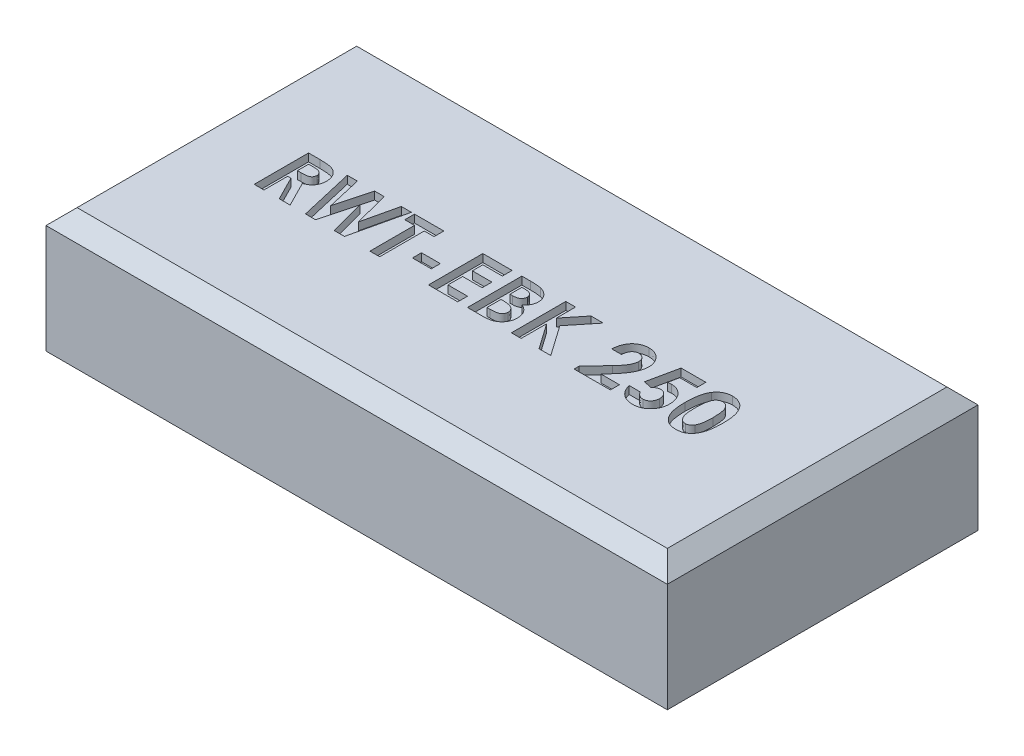
from build123d import *

# Parameters (mm, degrees)
SKETCH1_W           = 40
SKETCH1_H           = 20
BOSS_EXTRUDE1_DEPTH = 8
CHAMFER1_SIZE       = 1
SKETCH4_W           = 1.211538461
SKETCH4_H           = 0.583333333
CUT_EXTRUDE3_DEPTH  = 0.5


with BuildPart() as part:
    # Sketch1 → Boss-Extrude1 (new body)
    with BuildSketch(Plane(origin=(0, 0, 0), x_dir=(1, 0, 0), z_dir=(0, 1, 0))):
        with Locations((0, 2.318501171)):
            Rectangle(SKETCH1_W, SKETCH1_H)
    extrude(amount=BOSS_EXTRUDE1_DEPTH)

    # Chamfer1
    chamfer1_edges = [part.edges().sort_by_distance(p)[0] for p in [
        (0, 8, 7.681498829),
        (-20, 8, -2.318501171),
        (0, 8, -12.318501171),
        (20, 8, -2.318501171),
    ]]
    chamfer(chamfer1_edges, length=CHAMFER1_SIZE)

    # Sketch4 → Cut-Extrude3 (cut)
    # profile 1 of 10: a face of its own
    with BuildSketch(Plane(origin=(0, 8, 0), x_dir=(1, 0, 0), z_dir=(0, 1, 0))):
        with BuildLine():
            Line((-14.596153846, 3.818501171), (-13.864182692, 3.818501171))
            add(Edge.make_bspline(
                [(-13.864182692, 3.818501171), (-13.815799622, 3.818329439), (-13.722745349, 3.81799915), (-13.588566169, 3.81278806), (-13.46530414, 3.805536401), (-13.352776761, 3.794470177), (-13.251032173, 3.779797701), (-13.159968404, 3.76250128), (-13.079588115, 3.742788301), (-13.009213411, 3.718224373), (-12.945703721, 3.690516634), (-12.886503859, 3.658679935), (-12.830307791, 3.623068786), (-12.777491125, 3.582746162), (-12.727594872, 3.538437457), (-12.6805249, 3.49009807), (-12.636946351, 3.437318103), (-12.597129066, 3.380431058), (-12.560838815, 3.320587191), (-12.528765845, 3.257704336), (-12.502684052, 3.191738763), (-12.479637993, 3.123643816), (-12.463038663, 3.052446065), (-12.451494071, 2.978838632), (-12.443041573, 2.902562411), (-12.442555595, 2.850743733), (-12.442307692, 2.824310466)],
                knots=[0, 0, 0, 0, 1.749336639, 3.364467119, 4.854658419, 6.213483162, 7.451590619, 8.570285859, 9.5643256, 10.440900261, 11.26203566, 12.067320669, 12.869050712, 13.665104639, 14.467235401, 15.27997916, 16.102287765, 16.939272006, 17.78853747, 18.631303466, 19.488103222, 20.351255419, 21.228522269, 22.127379805, 23.044756219, 24, 24, 24, 24], degree=3))
            add(Edge.make_bspline(
                [(-12.442307692, 2.824310466), (-12.442951654, 2.796720207), (-12.444214347, 2.742620739), (-12.451015895, 2.663153032), (-12.46344699, 2.587123888), (-12.48227569, 2.514755912), (-12.503916836, 2.4451484), (-12.532694008, 2.379585653), (-12.565171892, 2.317114157), (-12.603744925, 2.258617595), (-12.646076944, 2.20279664), (-12.695308193, 2.151790002), (-12.748249241, 2.102856265), (-12.807876098, 2.059060474), (-12.871560358, 2.017441316), (-12.940567358, 1.979723274), (-13.014446736, 1.944958206), (-13.066387598, 1.925570802), (-13.092948718, 1.91565662)],
                knots=[0, 0, 0, 0, 1.099860209, 2.156625411, 3.176576793, 4.16617041, 5.135385252, 6.078461593, 7.016046972, 7.938469504, 8.868247731, 9.803980173, 10.76021508, 11.73834243, 12.748633912, 13.790971185, 14.870363756, 16, 16, 16, 16], degree=3))
            Line((-13.092948718, 1.91565662), (-12.28525641, 0.318501171))
            Line((-12.28525641, 0.318501171), (-12.983573718, 0.318501171))
            Line((-12.983573718, 0.318501171), (-13.754807692, 1.844142197))
            Line((-13.754807692, 1.844142197), (-13.967948718, 1.844142197))
            Line((-13.967948718, 1.844142197), (-13.967948718, 0.318501171))
            Line((-13.967948718, 0.318501171), (-14.596153846, 0.318501171))
            Line((-14.596153846, 0.318501171), (-14.596153846, 3.818501171))
        make_face()
        with BuildLine():
            Line((-13.967948718, 2.472347325), (-13.723257212, 2.472347325))
            add(Edge.make_bspline(
                [(-13.723257212, 2.472347325), (-13.693341641, 2.472684254), (-13.636059751, 2.473329401), (-13.55368087, 2.476321861), (-13.4788612, 2.483532211), (-13.41127944, 2.492642218), (-13.350595524, 2.503161037), (-13.297350732, 2.518235143), (-13.250724642, 2.534387429), (-13.211269776, 2.554460531), (-13.177560445, 2.577288002), (-13.148454596, 2.603220576), (-13.124379885, 2.633234229), (-13.104565169, 2.666513318), (-13.089151475, 2.70335219), (-13.07790066, 2.743346436), (-13.071613117, 2.786951643), (-13.070889714, 2.817045173), (-13.070512821, 2.832723927)],
                knots=[0, 0, 0, 0, 1.688639943, 3.233382647, 4.650958383, 5.928841754, 7.082724185, 8.122798841, 9.049171256, 9.863274652, 10.613301712, 11.341792392, 12.054588806, 12.776240173, 13.521029143, 14.301969904, 15.115324896, 16, 16, 16, 16], degree=3))
            add(Edge.make_bspline(
                [(-13.070512821, 2.832723927), (-13.071225372, 2.851273039), (-13.072625049, 2.88770933), (-13.086514186, 2.940164814), (-13.108622693, 2.988715953), (-13.1389274, 3.033143381), (-13.177092239, 3.072091531), (-13.220889403, 3.106424636), (-13.27126414, 3.133572687), (-13.317907356, 3.151479252), (-13.36034178, 3.162192934), (-13.398637509, 3.170176676), (-13.442984193, 3.175834983), (-13.493415313, 3.181836624), (-13.549802317, 3.185728385), (-13.612452548, 3.188568594), (-13.681186076, 3.189730664), (-13.729099873, 3.190102157), (-13.754106571, 3.190296043)],
                knots=[0, 0, 0, 0, 1.020303359, 2.004196876, 2.966617323, 3.9489082, 4.950758222, 5.960522915, 7.003732012, 8.091992268, 8.70421221, 9.413913587, 10.24622431, 11.166358409, 12.212345909, 13.359657661, 14.621978493, 16, 16, 16, 16], degree=3))
            Line((-13.754106571, 3.190296043), (-13.967948718, 3.190296043))
            Line((-13.967948718, 3.190296043), (-13.967948718, 2.472347325))
        make_face(mode=Mode.SUBTRACT)
    # profile 2 of 10: a face of its own
    with BuildSketch(Plane(origin=(0, 8, 0), x_dir=(1, 0, 0), z_dir=(0, 1, 0))):
        Polygon((-12.105769231, 3.818501171), (-11.457231571, 3.818501171), (-10.939102564, 1.584026011), (-10.345252404, 3.818501171), (-9.734575321, 3.818501171), (-9.144230769, 1.584026011), (-8.627504006, 3.818501171), (-7.977564103, 3.818501171), (-8.787359776, 0.318501171), (-9.443609776, 0.318501171), (-10.041666667, 2.581021203), (-10.643229167, 0.318501171), (-11.294571314, 0.318501171), align=None)
    # profile 3 of 10: a face of its own
    with BuildSketch(Plane(origin=(0, 8, 0), x_dir=(1, 0, 0), z_dir=(0, 1, 0))):
        Polygon((-7.775641026, 3.818501171), (-5.891025641, 3.818501171), (-5.891025641, 3.190296043), (-6.519230769, 3.190296043), (-6.519230769, 0.318501171), (-7.147435897, 0.318501171), (-7.147435897, 3.190296043), (-7.775641026, 3.190296043), align=None)
    # profile 4 of 10: a face of its own
    with BuildSketch(Plane(origin=(0, 8, 0), x_dir=(1, 0, 0), z_dir=(0, 1, 0))):
        with Locations((-4.791666667, 1.597347325)):
            Rectangle(SKETCH4_W, SKETCH4_H)
    # profile 5 of 10: a face of its own
    with BuildSketch(Plane(origin=(0, 8, 0), x_dir=(1, 0, 0), z_dir=(0, 1, 0))):
        Polygon((-3.378205128, 3.818501171), (-1.493589744, 3.818501171), (-1.493589744, 3.190296043), (-2.75, 3.190296043), (-2.75, 2.51721912), (-1.493589744, 2.51721912), (-1.493589744, 1.889013991), (-2.75, 1.889013991), (-2.75, 0.946706299), (-1.493589744, 0.946706299), (-1.493589744, 0.318501171), (-3.378205128, 0.318501171), align=None)
    # profile 6 of 10: a face of its own
    with BuildSketch(Plane(origin=(0, 8, 0), x_dir=(1, 0, 0), z_dir=(0, 1, 0))):
        with BuildLine():
            Line((-0.865384615, 0.318501171), (-0.865384615, 3.818501171))
            Line((-0.865384615, 3.818501171), (-0.304487179, 3.818501171))
            add(Edge.make_bspline(
                [(-0.304487179, 3.818501171), (-0.265220852, 3.818505652), (-0.189241252, 3.818514323), (-0.079622519, 3.814664873), (0.022039599, 3.809685178), (0.115421572, 3.804114058), (0.200682344, 3.794513904), (0.277692262, 3.784396391), (0.346605192, 3.772195293), (0.389210312, 3.76125053), (0.409254808, 3.756101331)],
                knots=[0, 0, 0, 0, 1.311965854, 2.538629056, 3.664479157, 4.713267157, 5.663616078, 6.530575999, 7.308677837, 8, 8, 8, 8], degree=3))
            add(Edge.make_bspline(
                [(0.409254808, 3.756101331), (0.435575266, 3.748838294), (0.487224455, 3.734585883), (0.561202576, 3.705802524), (0.631381143, 3.673807779), (0.697674471, 3.637307759), (0.759675491, 3.595861807), (0.817148578, 3.549140995), (0.871333285, 3.499020694), (0.920305637, 3.444104065), (0.964568575, 3.386074475), (1.003025131, 3.324947127), (1.03643895, 3.2616567), (1.063178757, 3.195406725), (1.083326699, 3.126502301), (1.09806282, 3.055237661), (1.107613822, 2.981387306), (1.108516267, 2.931144495), (1.108974359, 2.905640594)],
                knots=[0, 0, 0, 0, 1.099996261, 2.158545794, 3.195537121, 4.207578794, 5.205712374, 6.197378256, 7.190519799, 8.17788031, 9.159561366, 10.129234751, 11.085776129, 12.040971148, 13.00380137, 13.975669004, 14.972423361, 16, 16, 16, 16], degree=3))
            add(Edge.make_bspline(
                [(1.108974359, 2.905640594), (1.107776583, 2.872874775), (1.105418909, 2.808379286), (1.090357925, 2.713647082), (1.062116233, 2.624111532), (1.025162666, 2.538122532), (0.974917368, 2.456000819), (0.911115557, 2.377785442), (0.834790614, 2.30106803), (0.776245169, 2.255081117), (0.745793269, 2.231161427)],
                knots=[0, 0, 0, 0, 0.986156485, 1.941127874, 2.875419072, 3.804401753, 4.751181392, 5.761612777, 6.835722519, 8, 8, 8, 8], degree=3))
            add(Edge.make_bspline(
                [(0.745793269, 2.231161427), (0.770470028, 2.218564156), (0.818854324, 2.193864392), (0.887545811, 2.153265354), (0.951146629, 2.110083128), (1.009941945, 2.065186558), (1.062698461, 2.016672412), (1.111594582, 1.967336144), (1.154218027, 1.914350989), (1.192333195, 1.85960544), (1.225462281, 1.802306775), (1.254314061, 1.742551757), (1.278684124, 1.680136252), (1.299321324, 1.615377904), (1.314712554, 1.548053973), (1.324747963, 1.478140383), (1.332431699, 1.405875574), (1.333029422, 1.35665059), (1.333333333, 1.331622165)],
                knots=[0, 0, 0, 0, 1.164658916, 2.283573913, 3.35186032, 4.395461096, 5.390182219, 6.362969632, 7.312859996, 8.245001507, 9.165155236, 10.092416118, 11.032087915, 11.979892451, 12.947605196, 13.931445124, 14.948243989, 16, 16, 16, 16], degree=3))
            add(Edge.make_bspline(
                [(1.333333333, 1.331622165), (1.331361149, 1.283819302), (1.327469051, 1.189480545), (1.29901193, 1.050969584), (1.249676325, 0.91964863), (1.18342878, 0.796039608), (1.101799059, 0.683720797), (1.007948289, 0.585330494), (0.902821331, 0.502045287), (0.805829006, 0.445834233), (0.721938284, 0.40811136), (0.652453165, 0.384788701), (0.577827621, 0.363182624), (0.49669469, 0.348010391), (0.410525202, 0.334123096), (0.318478999, 0.325548791), (0.220728113, 0.319738197), (0.153588579, 0.318921849), (0.118990385, 0.318501171)],
                knots=[0, 0, 0, 0, 1.284142165, 2.534249414, 3.780121997, 5.041676246, 6.291546858, 7.49970053, 8.684500223, 9.883330709, 10.50184324, 11.153274765, 11.851151195, 12.587658647, 13.369265475, 14.195992086, 15.070362669, 16, 16, 16, 16], degree=3))
            Line((0.118990385, 0.318501171), (-0.865384615, 0.318501171))
        make_face()
        with BuildLine():
            Line((-0.237179487, 3.190296043), (-0.237179487, 2.42747553))
            Line((-0.237179487, 2.42747553), (-0.0703125, 2.42747553))
            add(Edge.make_bspline(
                [(-0.0703125, 2.42747553), (-0.047633777, 2.427673297), (-0.003853875, 2.428055074), (0.059381549, 2.432972233), (0.118180282, 2.441361212), (0.172319311, 2.453065948), (0.222302963, 2.467929257), (0.267811927, 2.485813017), (0.308646108, 2.507633149), (0.356085982, 2.540135198), (0.406233349, 2.587963419), (0.450377513, 2.657061193), (0.476378131, 2.736523371), (0.479273899, 2.792566252), (0.480769231, 2.821505979)],
                knots=[0, 0, 0, 0, 1.065314748, 2.056525647, 2.977365736, 3.853934255, 4.656397591, 5.425096493, 6.14721249, 6.826394842, 8.123232004, 9.372140726, 10.643011755, 12, 12, 12, 12], degree=3))
            add(Edge.make_bspline(
                [(0.480769231, 2.821505979), (0.479572691, 2.848612841), (0.47725923, 2.901022871), (0.451079951, 2.97461122), (0.410418355, 3.039825558), (0.362411626, 3.084459439), (0.317203962, 3.114943064), (0.278494386, 3.135015233), (0.236007719, 3.152983634), (0.188921466, 3.166722711), (0.137504514, 3.17703203), (0.082006625, 3.184602991), (0.022332045, 3.189756109), (-0.018885315, 3.190112204), (-0.040164263, 3.190296043)],
                knots=[0, 0, 0, 0, 1.347982417, 2.606269829, 3.849316587, 5.153353503, 5.842674298, 6.568177932, 7.326619318, 8.142485038, 9.012069166, 9.942760135, 10.937925643, 12, 12, 12, 12], degree=3))
            Line((-0.040164263, 3.190296043), (-0.237179487, 3.190296043))
        make_face(mode=Mode.SUBTRACT)
        with BuildLine():
            Line((-0.237179487, 1.844142197), (-0.237179487, 0.946706299))
            Line((-0.237179487, 0.946706299), (-0.056290064, 0.946706299))
            add(Edge.make_bspline(
                [(-0.056290064, 0.946706299), (-0.020527995, 0.946910607), (0.048229046, 0.947303413), (0.146723385, 0.952049449), (0.236279363, 0.960603342), (0.316659689, 0.971282188), (0.387987483, 0.985750355), (0.450021639, 1.004144774), (0.503612874, 1.02438184), (0.548439854, 1.049377018), (0.585060929, 1.078465208), (0.618107609, 1.108194036), (0.645051813, 1.142489048), (0.666370569, 1.179878054), (0.684821916, 1.219432285), (0.695950465, 1.262696318), (0.704423352, 1.308387911), (0.704889637, 1.339991798), (0.705128205, 1.356161427)],
                knots=[0, 0, 0, 0, 1.753078804, 3.370512758, 4.83203934, 6.162291463, 7.344201807, 8.395507345, 9.331626367, 10.147333109, 10.898971645, 11.62040215, 12.321813352, 13.025280112, 13.727906689, 14.453419512, 15.208716525, 16, 16, 16, 16], degree=3))
            add(Edge.make_bspline(
                [(0.705128205, 1.356161427), (0.704602095, 1.374651653), (0.703577374, 1.410665639), (0.695208464, 1.463303922), (0.67999942, 1.512445252), (0.660842888, 1.559346239), (0.634185556, 1.602327663), (0.602504228, 1.642876951), (0.564225095, 1.679620976), (0.521177978, 1.714782156), (0.470967777, 1.745567673), (0.413570936, 1.772279563), (0.348675643, 1.79458835), (0.27608088, 1.81235062), (0.196104895, 1.827425213), (0.108163951, 1.83642641), (0.012990452, 1.843120995), (-0.053004401, 1.843794061), (-0.087139423, 1.844142197)],
                knots=[0, 0, 0, 0, 0.845221588, 1.646264278, 2.427170338, 3.19324141, 3.95557735, 4.731569926, 5.540061037, 6.376114724, 7.268642756, 8.224665384, 9.265483498, 10.400594375, 11.639216012, 12.983232105, 14.439614077, 16, 16, 16, 16], degree=3))
            Line((-0.087139423, 1.844142197), (-0.237179487, 1.844142197))
        make_face(mode=Mode.SUBTRACT)
    # profile 7 of 10: a face of its own
    with BuildSketch(Plane(origin=(0, 8, 0), x_dir=(1, 0, 0), z_dir=(0, 1, 0))):
        Polygon((1.961538462, 3.818501171), (2.58974359, 3.818501171), (2.58974359, 2.586630177), (3.582532051, 3.818501171), (4.375500801, 3.818501171), (3.128205128, 2.270424248), (4.496794872, 0.318501171), (3.740284455, 0.318501171), (2.58974359, 1.959827293), (2.58974359, 0.318501171), (1.961538462, 0.318501171), align=None)
    # profile 8 of 10: a face of its own
    with BuildSketch(Plane(origin=(0, 8, 0), x_dir=(1, 0, 0), z_dir=(0, 1, 0))):
        with BuildLine():
            Line((6.717948718, 2.651834504), (6.08974359, 2.651834504))
            add(Edge.make_bspline(
                [(6.08974359, 2.651834504), (6.092456711, 2.699354899), (6.097757988, 2.792206896), (6.118845127, 2.927077396), (6.147101169, 3.054515188), (6.184812609, 3.174074479), (6.232199501, 3.285711827), (6.288042457, 3.389807809), (6.353768139, 3.485814357), (6.427977688, 3.573268474), (6.50941123, 3.65172437), (6.596378125, 3.721288296), (6.690208648, 3.778690696), (6.789188439, 3.825927558), (6.893300645, 3.863667615), (7.003530329, 3.888899897), (7.118923064, 3.905987446), (7.197918735, 3.907482675), (7.23818109, 3.908244761)],
                knots=[0, 0, 0, 0, 1.199038563, 2.342849363, 3.436047546, 4.486744587, 5.497670872, 6.488682221, 7.459191391, 8.424610317, 9.374430501, 10.305433194, 11.225809216, 12.140057399, 13.06607119, 14.010487599, 14.985989317, 16, 16, 16, 16], degree=3))
            add(Edge.make_bspline(
                [(7.23818109, 3.908244761), (7.287602559, 3.906702681), (7.38408485, 3.903692179), (7.52428127, 3.878011599), (7.655209399, 3.835056862), (7.776774062, 3.775037765), (7.88794036, 3.698789794), (7.988689856, 3.607876567), (8.075975727, 3.500390678), (8.15035139, 3.380804438), (8.212148677, 3.254179441), (8.255453641, 3.123243943), (8.283917528, 2.991472441), (8.286953378, 2.902744181), (8.288461538, 2.858665434)],
                knots=[0, 0, 0, 0, 1.075374347, 2.099382735, 3.09057751, 4.06680945, 5.040638231, 6.016817125, 7.011024321, 8.044445721, 9.0776792, 10.070479129, 11.0414456, 12, 12, 12, 12], degree=3))
            add(Edge.make_bspline(
                [(8.288461538, 2.858665434), (8.28787434, 2.832003492), (8.286692456, 2.778339588), (8.278474655, 2.697132932), (8.26614633, 2.614414458), (8.24755822, 2.53025509), (8.224377324, 2.444631236), (8.196255546, 2.357286655), (8.162540574, 2.268716557), (8.123795042, 2.177924102), (8.077571525, 2.084614522), (8.023750665, 1.98738907), (7.960903933, 1.886333992), (7.889790439, 1.7808787), (7.810064803, 1.671189511), (7.721337829, 1.557596844), (7.624631444, 1.439700436), (7.555996202, 1.360893303), (7.520733173, 1.320404216)],
                knots=[0, 0, 0, 0, 0.728284026, 1.46585585, 2.227944881, 3.01186502, 3.81876927, 4.650621989, 5.517437689, 6.406905708, 7.346299482, 8.360816762, 9.441613733, 10.596154504, 11.834900912, 13.145207542, 14.533280747, 16, 16, 16, 16], degree=3))
            Line((7.520733173, 1.320404216), (7.155448718, 0.901834504))
            Line((7.155448718, 0.901834504), (8.333333333, 0.901834504))
            Line((8.333333333, 0.901834504), (8.333333333, 0.318501171))
            Line((8.333333333, 0.318501171), (6, 0.318501171))
            Line((6, 0.318501171), (6, 0.636810466))
            Line((6, 0.636810466), (7.036258013, 1.739675049))
            add(Edge.make_bspline(
                [(7.036258013, 1.739675049), (7.066260345, 1.771845952), (7.124365966, 1.834151449), (7.207044276, 1.9256537), (7.281860843, 2.012487153), (7.347264285, 2.095576408), (7.40668689, 2.172226387), (7.457479009, 2.244747418), (7.50010535, 2.312483883), (7.546382289, 2.39416223), (7.590330169, 2.491578193), (7.630655009, 2.603805377), (7.655235789, 2.711068718), (7.658628714, 2.780963817), (7.66025641, 2.814494761)],
                knots=[0, 0, 0, 0, 1.246127091, 2.413378631, 3.493388633, 4.492180848, 5.408488754, 6.240484944, 6.999099869, 7.674939598, 8.898438119, 10.020720584, 11.050475521, 12, 12, 12, 12], degree=3))
            add(Edge.make_bspline(
                [(7.66025641, 2.814494761), (7.659039421, 2.846933362), (7.65668131, 2.909788353), (7.630767577, 2.999199244), (7.590621122, 3.080151677), (7.534049098, 3.150226705), (7.465522659, 3.207812002), (7.386333921, 3.250642327), (7.297128506, 3.275355229), (7.234593811, 3.278448401), (7.202423878, 3.280039632)],
                knots=[0, 0, 0, 0, 1.062038974, 2.057870785, 3.028805853, 4.01125022, 4.991535629, 5.949134679, 6.94496649, 8, 8, 8, 8], degree=3))
            add(Edge.make_bspline(
                [(7.202423878, 3.280039632), (7.185804481, 3.279451813), (7.153086529, 3.278294595), (7.104993697, 3.27059131), (7.059229913, 3.257015074), (7.015285799, 3.238824829), (6.973630338, 3.214713529), (6.9343686, 3.184992509), (6.897086913, 3.15041705), (6.861956264, 3.111095263), (6.829982787, 3.067212138), (6.801584062, 3.019168456), (6.778103044, 2.966994041), (6.757429502, 2.911377673), (6.741485078, 2.851721988), (6.729875559, 2.788384019), (6.721049617, 2.721466807), (6.719001154, 2.675467517), (6.717948718, 2.651834504)],
                knots=[0, 0, 0, 0, 0.903469896, 1.778625579, 2.63899355, 3.493148037, 4.358286772, 5.247621495, 6.164656832, 7.118446693, 8.109501108, 9.111810964, 10.146451449, 11.215617525, 12.33435995, 13.498009769, 14.714554818, 16, 16, 16, 16], degree=3))
        make_face()
    # profile 9 of 10: a face of its own
    with BuildSketch(Plane(origin=(0, 8, 0), x_dir=(1, 0, 0), z_dir=(0, 1, 0))):
        with BuildLine():
            Line((9.387119391, 3.818501171), (10.980769231, 3.818501171))
            Line((10.980769231, 3.818501171), (10.980769231, 3.235167838))
            Line((10.980769231, 3.235167838), (9.884915865, 3.235167838))
            Line((9.884915865, 3.235167838), (9.748197115, 2.573308863))
            add(Edge.make_bspline(
                [(9.748197115, 2.573308863), (9.766827002, 2.578497522), (9.803568967, 2.588730623), (9.858920782, 2.598993128), (9.912564404, 2.605644958), (9.947765022, 2.606532224), (9.96484375, 2.606962709)],
                knots=[0, 0, 0, 0, 1.05461699, 2.079921384, 3.068411212, 4, 4, 4, 4], degree=3))
            add(Edge.make_bspline(
                [(9.96484375, 2.606962709), (10.002060088, 2.606109919), (10.075421688, 2.60442888), (10.1827404, 2.588470341), (10.285504407, 2.563336125), (10.383399238, 2.527489548), (10.476329265, 2.480834303), (10.564407137, 2.424394534), (10.647740954, 2.358071113), (10.724850358, 2.281822516), (10.795701698, 2.19809983), (10.857302898, 2.107544887), (10.909914167, 2.011448911), (10.951759351, 1.909214572), (10.984787138, 1.801483971), (11.008653754, 1.688188071), (11.022767277, 1.569192598), (11.024670399, 1.488010495), (11.025641026, 1.446606139)],
                knots=[0, 0, 0, 0, 1.01440847, 1.999622559, 2.951875003, 3.895578053, 4.836219714, 5.782137149, 6.743708247, 7.735272588, 8.734977101, 9.730283169, 10.717124674, 11.717316708, 12.737475749, 13.78628267, 14.87096371, 16, 16, 16, 16], degree=3))
            add(Edge.make_bspline(
                [(11.025641026, 1.446606139), (11.024454904, 1.404731748), (11.022114339, 1.322101333), (11.006844297, 1.200605395), (10.979892399, 1.084239715), (10.94287127, 0.972692784), (10.894098303, 0.866784445), (10.835442135, 0.765417568), (10.765911048, 0.669344566), (10.68618738, 0.579550304), (10.599517296, 0.497476624), (10.507234115, 0.425276252), (10.409986156, 0.364520223), (10.30777107, 0.31541908), (10.2011753, 0.276571129), (10.090166491, 0.248291676), (9.974205155, 0.232074981), (9.895482475, 0.229875532), (9.85546875, 0.228757581)],
                knots=[0, 0, 0, 0, 1.06808661, 2.107647099, 3.116961351, 4.110378221, 5.100014249, 6.085620622, 7.093190682, 8.119403071, 9.144090782, 10.133780668, 11.103064255, 12.062861538, 13.020824475, 13.992378307, 14.979551724, 16, 16, 16, 16], degree=3))
            add(Edge.make_bspline(
                [(9.85546875, 0.228757581), (9.819685666, 0.229672135), (9.749113937, 0.231475826), (9.645164879, 0.242562264), (9.544946443, 0.262163189), (9.44899068, 0.290530803), (9.356287975, 0.32544486), (9.267909998, 0.369111487), (9.183371097, 0.420699211), (9.102911331, 0.479266557), (9.027838055, 0.545240399), (8.959319124, 0.617460138), (8.896939715, 0.695015476), (8.84203465, 0.778863212), (8.79477604, 0.868879466), (8.75286614, 0.964003375), (8.718562467, 1.065228337), (8.701154341, 1.135403104), (8.692307692, 1.171065274)],
                knots=[0, 0, 0, 0, 1.054957082, 2.080596141, 3.077793124, 4.061112343, 5.027190972, 5.994718051, 6.962465889, 7.943658696, 8.924948258, 9.904494768, 10.875059, 11.855380583, 12.854004648, 13.869083016, 14.917087635, 16, 16, 16, 16], degree=3))
            Line((8.692307692, 1.171065274), (9.41025641, 1.171065274))
            add(Edge.make_bspline(
                [(9.41025641, 1.171065274), (9.42338053, 1.146352842), (9.448885759, 1.098327052), (9.497402344, 1.034565599), (9.551713581, 0.980192572), (9.611329552, 0.934676733), (9.676636533, 0.900577041), (9.744973386, 0.874717413), (9.8171986, 0.859774091), (9.86638716, 0.857906028), (9.891225962, 0.856962709)],
                knots=[0, 0, 0, 0, 1.104910296, 2.147267069, 3.153527244, 4.136738762, 5.099945312, 6.05603338, 7.018353, 8, 8, 8, 8], degree=3))
            add(Edge.make_bspline(
                [(9.891225962, 0.856962709), (9.908538273, 0.857614079), (9.942600538, 0.858895659), (9.9927859, 0.86567554), (10.040690032, 0.87851648), (10.086669091, 0.896298197), (10.130846587, 0.918474006), (10.172589223, 0.946469521), (10.212623243, 0.978693396), (10.250339168, 1.015670402), (10.284498925, 1.056891163), (10.314453296, 1.10118568), (10.341236634, 1.14756972), (10.361075462, 1.197880672), (10.377321784, 1.250616232), (10.389286233, 1.306174201), (10.396436341, 1.364619465), (10.397098249, 1.404518409), (10.397435897, 1.424871363)],
                knots=[0, 0, 0, 0, 0.978869489, 1.925942215, 2.855067702, 3.774946051, 4.70828698, 5.642468714, 6.60995405, 7.609372294, 8.622401667, 9.629904756, 10.629323, 11.642352373, 12.678539694, 13.745912462, 14.850161547, 16, 16, 16, 16], degree=3))
            add(Edge.make_bspline(
                [(10.397435897, 1.424871363), (10.397044018, 1.444751879), (10.396281215, 1.483449786), (10.389971156, 1.540272174), (10.378682582, 1.594186337), (10.363301804, 1.645605217), (10.343612571, 1.694216573), (10.319551013, 1.740309765), (10.291014335, 1.783651807), (10.257849331, 1.823360298), (10.222482512, 1.859782055), (10.184487184, 1.891636234), (10.144205664, 1.918072991), (10.102889652, 1.941153049), (10.05888996, 1.957950212), (10.013195966, 1.969517798), (9.965855722, 1.978005628), (9.933565969, 1.978504319), (9.917167468, 1.978757581)],
                knots=[0, 0, 0, 0, 1.166249705, 2.270133367, 3.348514167, 4.393962215, 5.415026464, 6.420877785, 7.440098956, 8.453121383, 9.451844239, 10.415694839, 11.355045125, 12.27538808, 13.187007209, 14.108269027, 15.039275622, 16, 16, 16, 16], degree=3))
            add(Edge.make_bspline(
                [(9.917167468, 1.978757581), (9.899354884, 1.978081693), (9.863654645, 1.976727067), (9.810613025, 1.965704839), (9.75821094, 1.94786674), (9.706156979, 1.923256255), (9.654967869, 1.891048895), (9.603292704, 1.853273355), (9.552861163, 1.807184883), (9.520795387, 1.772858084), (9.504206731, 1.755099729)],
                knots=[0, 0, 0, 0, 0.88288272, 1.769486374, 2.674910571, 3.623812639, 4.617874466, 5.670434592, 6.794841017, 8, 8, 8, 8], degree=3))
            Line((9.504206731, 1.755099729), (8.975560897, 1.876393799))
            Line((8.975560897, 1.876393799), (9.387119391, 3.818501171))
        make_face()
    # profile 10 of 10: a face of its own
    with BuildSketch(Plane(origin=(0, 8, 0), x_dir=(1, 0, 0), z_dir=(0, 1, 0))):
        with BuildLine():
            add(Edge.make_bspline(
                [(12.608072917, 3.908244761), (12.638480652, 3.907793349), (12.698270385, 3.906905754), (12.786329406, 3.897292372), (12.871154591, 3.882769234), (12.953077785, 3.86251452), (13.031509297, 3.835708128), (13.107019968, 3.803621336), (13.178711003, 3.764571127), (13.247496691, 3.720461909), (13.313350535, 3.670524021), (13.374689786, 3.613592251), (13.432634627, 3.550976601), (13.485930767, 3.481730434), (13.535758465, 3.406483618), (13.581953994, 3.325224221), (13.624163718, 3.237554532), (13.662860706, 3.143316345), (13.697463675, 3.04109707), (13.726609713, 2.929724208), (13.751607317, 2.809172324), (13.772707059, 2.679141347), (13.788655053, 2.539458435), (13.799404323, 2.390216385), (13.80678098, 2.231702915), (13.807383012, 2.122963977), (13.807692308, 2.067098927)],
                knots=[0, 0, 0, 0, 0.879237366, 1.728815576, 2.559023295, 3.367336655, 4.166867292, 4.954216142, 5.737608147, 6.525189134, 7.316157332, 8.124696809, 8.942788509, 9.781158001, 10.649253743, 11.551476218, 12.482711956, 13.461909668, 14.496590415, 15.601789533, 16.789733467, 18.056700938, 19.410929216, 20.8549011, 22.384193279, 24, 24, 24, 24], degree=3))
            add(Edge.make_bspline(
                [(13.807692308, 2.067098927), (13.807358042, 2.010534943), (13.806708571, 1.900632136), (13.799710973, 1.740668821), (13.787660778, 1.590343185), (13.772129618, 1.449670779), (13.750856176, 1.31872589), (13.725942019, 1.19716946), (13.69633592, 1.085045549), (13.660593141, 0.982606796), (13.622130387, 0.888203106), (13.579805201, 0.800704352), (13.534355307, 0.71987354), (13.486823186, 0.644491226), (13.434602955, 0.576779642), (13.380236318, 0.514436242), (13.321356056, 0.459835764), (13.260441254, 0.410164346), (13.195260358, 0.367238273), (13.12648556, 0.329695837), (13.052890726, 0.299244462), (12.975817364, 0.272759483), (12.893951743, 0.253746125), (12.808594697, 0.238659651), (12.718782561, 0.23032194), (12.657634842, 0.229287592), (12.626302083, 0.228757581)],
                knots=[0, 0, 0, 0, 1.643780988, 3.193836972, 4.651895693, 6.025988579, 7.305620092, 8.505800249, 9.631074763, 10.672816429, 11.65661981, 12.592235626, 13.49536222, 14.350718032, 15.179365177, 15.97804903, 16.751647189, 17.51006938, 18.259804725, 19.016521909, 19.783502495, 20.571750527, 21.382245291, 22.22305063, 23.089471752, 24, 24, 24, 24], degree=3))
            add(Edge.make_bspline(
                [(12.626302083, 0.228757581), (12.59497017, 0.229297816), (12.533591414, 0.230356128), (12.443536417, 0.238597657), (12.357727022, 0.253807241), (12.275213712, 0.272905453), (12.196570768, 0.299185861), (12.1214211, 0.330548319), (12.050342543, 0.367856509), (11.983138292, 0.410882596), (11.920037802, 0.460221675), (11.86006049, 0.515346009), (11.803339031, 0.576115872), (11.750736299, 0.643211936), (11.701390812, 0.71573861), (11.655817167, 0.794524112), (11.614042751, 0.879453732), (11.574760854, 0.970645855), (11.540629858, 1.070063741), (11.510254856, 1.17859518), (11.485372454, 1.297144871), (11.46536036, 1.425674728), (11.449382717, 1.563912456), (11.437497186, 1.711924777), (11.43046072, 1.869780633), (11.429818059, 1.978282826), (11.429487179, 2.034146203)],
                knots=[0, 0, 0, 0, 0.917216111, 1.796812873, 2.643793957, 3.46689424, 4.273913431, 5.068098542, 5.848489301, 6.620921603, 7.401012384, 8.190319798, 9.003608147, 9.831726257, 10.68377682, 11.569763213, 12.493818149, 13.453288342, 14.474581811, 15.568529029, 16.750744269, 18.018426408, 19.375425659, 20.823733699, 22.36466933, 24, 24, 24, 24], degree=3))
            add(Edge.make_bspline(
                [(11.429487179, 2.034146203), (11.430086537, 2.111763968), (11.431243006, 2.261528446), (11.445898626, 2.477894573), (11.46740936, 2.677887577), (11.499003532, 2.861172919), (11.538069289, 3.028429436), (11.588095025, 3.178555327), (11.645045686, 3.313627923), (11.693574966, 3.393645742), (11.716947115, 3.432183062)],
                knots=[0, 0, 0, 0, 1.288568992, 2.486310467, 3.599230591, 4.627010532, 5.572937695, 6.447898582, 7.252493626, 8, 8, 8, 8], degree=3))
            add(Edge.make_bspline(
                [(11.716947115, 3.432183062), (11.744123137, 3.470042113), (11.797257615, 3.544064019), (11.890164735, 3.641240945), (11.989981339, 3.72435141), (12.098757603, 3.791514551), (12.214773185, 3.844479409), (12.339024139, 3.881887892), (12.471051626, 3.903683818), (12.561717103, 3.906701743), (12.608072917, 3.908244761)],
                knots=[0, 0, 0, 0, 1.058512271, 2.069600068, 3.047294572, 4.004278952, 4.967380941, 5.939006123, 6.946246673, 8, 8, 8, 8], degree=3))
        make_face()
        with BuildLine():
            add(Edge.make_bspline(
                [(12.623497596, 3.280039632), (12.596008751, 3.278736716), (12.542116023, 3.276182308), (12.463915106, 3.254498986), (12.390176524, 3.221007927), (12.334085555, 3.180706674), (12.292102022, 3.142073089), (12.262767826, 3.107110952), (12.234479618, 3.068095726), (12.209494048, 3.023266856), (12.185901148, 2.974235095), (12.162843773, 2.920777869), (12.14394278, 2.861582152), (12.125373055, 2.797656056), (12.109104244, 2.727232193), (12.095474546, 2.649734927), (12.08329761, 2.564660285), (12.074804052, 2.471952543), (12.066885506, 2.371708697), (12.061209118, 2.263705442), (12.058835962, 2.147971914), (12.058081608, 2.068267952), (12.057692308, 2.027134985)],
                knots=[0, 0, 0, 0, 1.076674018, 2.110852608, 3.161083442, 4.239746716, 4.804137807, 5.395870207, 6.026861976, 6.692161227, 7.405688833, 8.16177676, 8.973626916, 9.841385931, 10.773283133, 11.807421078, 12.927755683, 14.143907515, 15.458935494, 16.872852025, 18.386167141, 20, 20, 20, 20], degree=3))
            add(Edge.make_bspline(
                [(12.057692308, 2.027134985), (12.05833305, 1.973845238), (12.05956172, 1.871658197), (12.065996919, 1.724709674), (12.078895741, 1.590974686), (12.094939272, 1.46954686), (12.117473067, 1.361213689), (12.143399656, 1.264950241), (12.175416688, 1.181983641), (12.212418538, 1.111114005), (12.253399754, 1.050825352), (12.297886667, 0.999579726), (12.344364656, 0.955203432), (12.394284452, 0.919157115), (12.44752696, 0.891532879), (12.503647703, 0.871663107), (12.562682345, 0.859499993), (12.603108659, 0.85781336), (12.623497596, 0.856962709)],
                knots=[0, 0, 0, 0, 1.771748488, 3.397459088, 4.888034009, 6.237357457, 7.467047327, 8.564189669, 9.548206622, 10.417051504, 11.216568818, 11.965764335, 12.669334354, 13.348544111, 14.005342236, 14.656555988, 15.322436492, 16, 16, 16, 16], degree=3))
            add(Edge.make_bspline(
                [(12.623497596, 0.856962709), (12.64318685, 0.857544788), (12.681735959, 0.858684424), (12.737949195, 0.87038264), (12.791108425, 0.889401398), (12.841053145, 0.916304766), (12.887962, 0.950516515), (12.931605729, 0.992186986), (12.971655179, 1.041731537), (12.994988171, 1.07850092), (13.007011218, 1.097447485)],
                knots=[0, 0, 0, 0, 0.992283464, 1.942767638, 2.88273346, 3.832339453, 4.79467288, 5.803907806, 6.868395428, 8, 8, 8, 8], degree=3))
            add(Edge.make_bspline(
                [(13.007011218, 1.097447485), (13.021166331, 1.12333736), (13.050848455, 1.177626329), (13.085196661, 1.269236938), (13.114109066, 1.372558565), (13.13899355, 1.487912756), (13.156013019, 1.615754481), (13.170670165, 1.755273086), (13.177739671, 1.907171129), (13.178889565, 2.012406641), (13.179487179, 2.067098927)],
                knots=[0, 0, 0, 0, 0.710965849, 1.490837728, 2.352621235, 3.297892224, 4.334225155, 5.461620853, 6.680770821, 8, 8, 8, 8], degree=3))
            add(Edge.make_bspline(
                [(13.179487179, 2.067098927), (13.179256334, 2.122265969), (13.178811995, 2.228453106), (13.170659668, 2.380897234), (13.15930693, 2.520129644), (13.142701151, 2.645839487), (13.121334799, 2.758331932), (13.095000689, 2.857599625), (13.063954732, 2.943838204), (13.027137927, 3.016961676), (12.986361029, 3.079106596), (12.943075106, 3.132422118), (12.897097128, 3.177941565), (12.848503986, 3.215836235), (12.796170975, 3.244790606), (12.741097722, 3.265234787), (12.683171324, 3.27760283), (12.64365732, 3.279216402), (12.623497596, 3.280039632)],
                knots=[0, 0, 0, 0, 1.793836731, 3.452829483, 4.963243077, 6.335886805, 7.574563692, 8.684454726, 9.672768357, 10.54971625, 11.340229787, 12.085688095, 12.778991901, 13.440269426, 14.083255152, 14.715733572, 15.344777694, 16, 16, 16, 16], degree=3))
        make_face(mode=Mode.SUBTRACT)
    extrude(amount=-CUT_EXTRUDE3_DEPTH, mode=Mode.SUBTRACT)


solid = part.part
